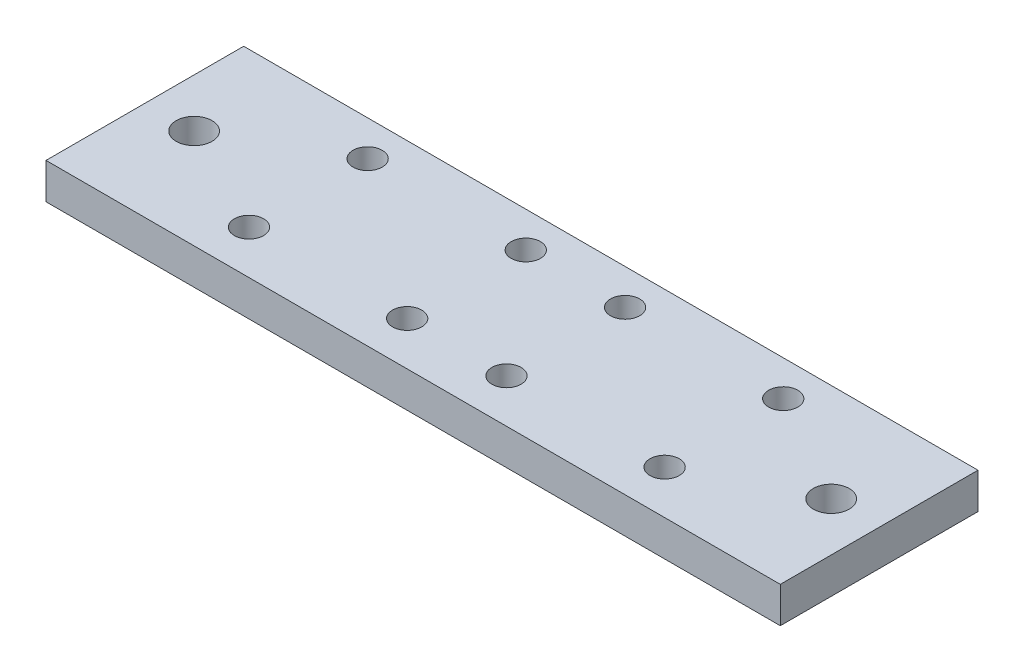
from build123d import *

# Parameters (mm, degrees)
SKETCH1_W           = 130
SKETCH1_H           = 35
BOSS_EXTRUDE1_DEPTH = 6.35
SKETCH5_R           = 3.18
CUT_EXTRUDE2_DEPTH  = 135.778790987
SKETCH8_R           = 2.58660254
CUT_EXTRUDE4_DEPTH  = 135.778790987


with BuildPart() as part:
    # Sketch1 → Boss-Extrude1 (new body)
    with BuildSketch(Plane(origin=(0, 0, 0), x_dir=(1, 0, 0), z_dir=(0, 1, 0))):
        with Locations((65, -17.5)):
            Rectangle(SKETCH1_W, SKETCH1_H)
    extrude(amount=BOSS_EXTRUDE1_DEPTH)

    # Sketch5 → Cut-Extrude2 (cut, through all)
    with BuildSketch(Plane(origin=(0, 6.35, 0), x_dir=(1, 0, 0), z_dir=(0, 1, 0))):
        with Locations((8.605, -17.382603272)):
            Circle(SKETCH5_R)
        with Locations((121.395, -17.382603272)):
            Circle(SKETCH5_R)
    extrude(amount=-CUT_EXTRUDE2_DEPTH, mode=Mode.SUBTRACT)

    # Sketch8 → Cut-Extrude4 (cut, through all)
    with BuildSketch(Plane.XZ):
        with Locations((28.209410616, 6.27121045)):
            Circle(SKETCH8_R)
        with Locations((28.209410616, 27.27121045)):
            Circle(SKETCH8_R)
        with Locations((56.209410616, 27.27121045)):
            Circle(SKETCH8_R)
        with Locations((56.209410616, 6.27121045)):
            Circle(SKETCH8_R)
        with Locations((73.791362744, 6.27121045)):
            Circle(SKETCH8_R)
        with Locations((73.791362744, 27.27121045)):
            Circle(SKETCH8_R)
        with Locations((101.791362744, 6.27121045)):
            Circle(SKETCH8_R)
        with Locations((101.791362744, 27.27121045)):
            Circle(SKETCH8_R)
    extrude(amount=-CUT_EXTRUDE4_DEPTH, mode=Mode.SUBTRACT)


solid = part.part
